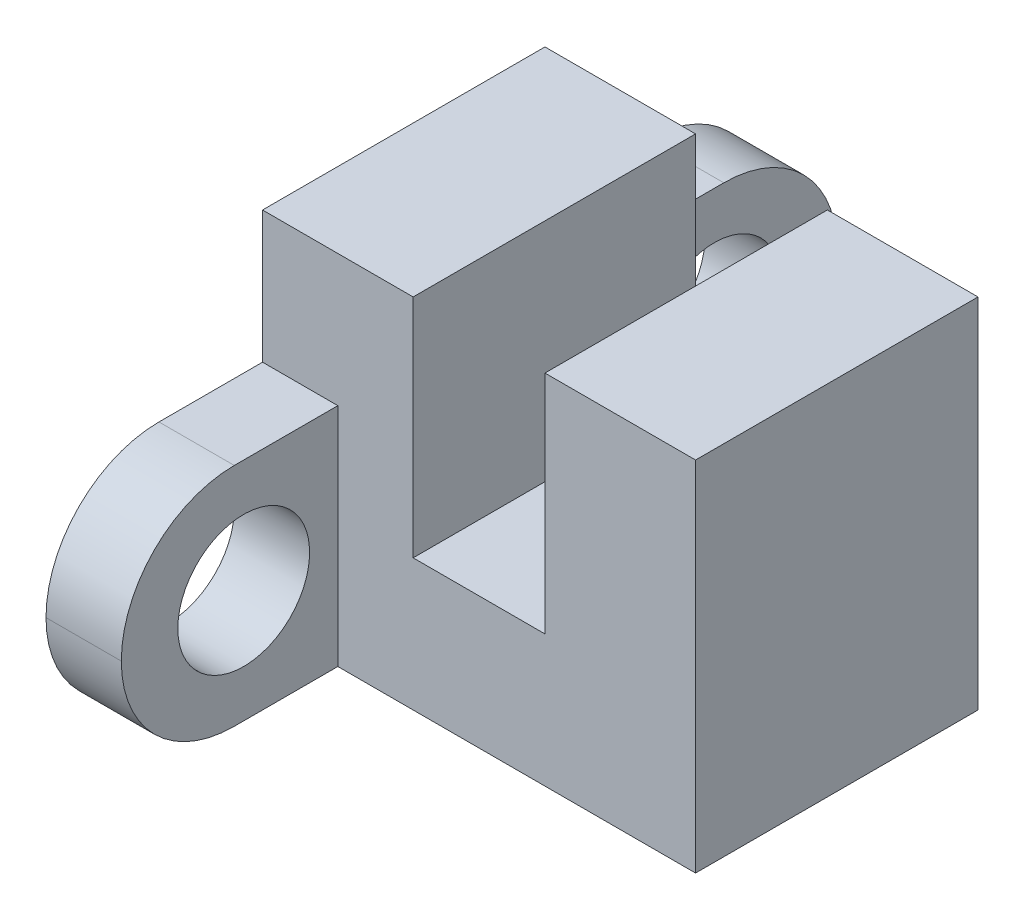
from build123d import *

# Parameters (mm, degrees)
BOSS_EXTRUDE2_DEPTH = 7.5
SKETCH3_W           = 19
SKETCH3_H           = 6
SKETCH3_R           = 1.75
BOSS_EXTRUDE3_DEPTH = 2
FILLET1_R           = 3


with BuildPart() as part:
    # Sketch2 → Boss-Extrude2 (new body)
    with BuildSketch(Plane.XY):
        Polygon((0, 9.5), (0, 0), (11.5, 0), (11.5, 9.5), (7.5, 9.5), (7.5, 3.5), (4, 3.5), (4, 9.5), align=None)
    extrude(amount=BOSS_EXTRUDE2_DEPTH)

    # Sketch3 → Boss-Extrude3 (add)
    with BuildSketch(Plane.ZY):
        with Locations((3.75, 3)):
            Rectangle(SKETCH3_W, SKETCH3_H)
        with Locations((-2.5, 3)):
            Circle(SKETCH3_R, mode=Mode.SUBTRACT)
        with Locations((10, 3)):
            Circle(SKETCH3_R, mode=Mode.SUBTRACT)
    extrude(amount=-BOSS_EXTRUDE3_DEPTH)

    # Fillet1
    fillet1_edges = [part.edges().sort_by_distance(p)[0] for p in [
        (1, 0, 13.25),
        (1, 6, 13.25),
        (1, 0, -5.75),
        (1, 6, -5.75),
    ]]
    fillet(fillet1_edges, radius=FILLET1_R - 0.0001)  # a hair under: the kernel refuses the full size


solid = part.part
